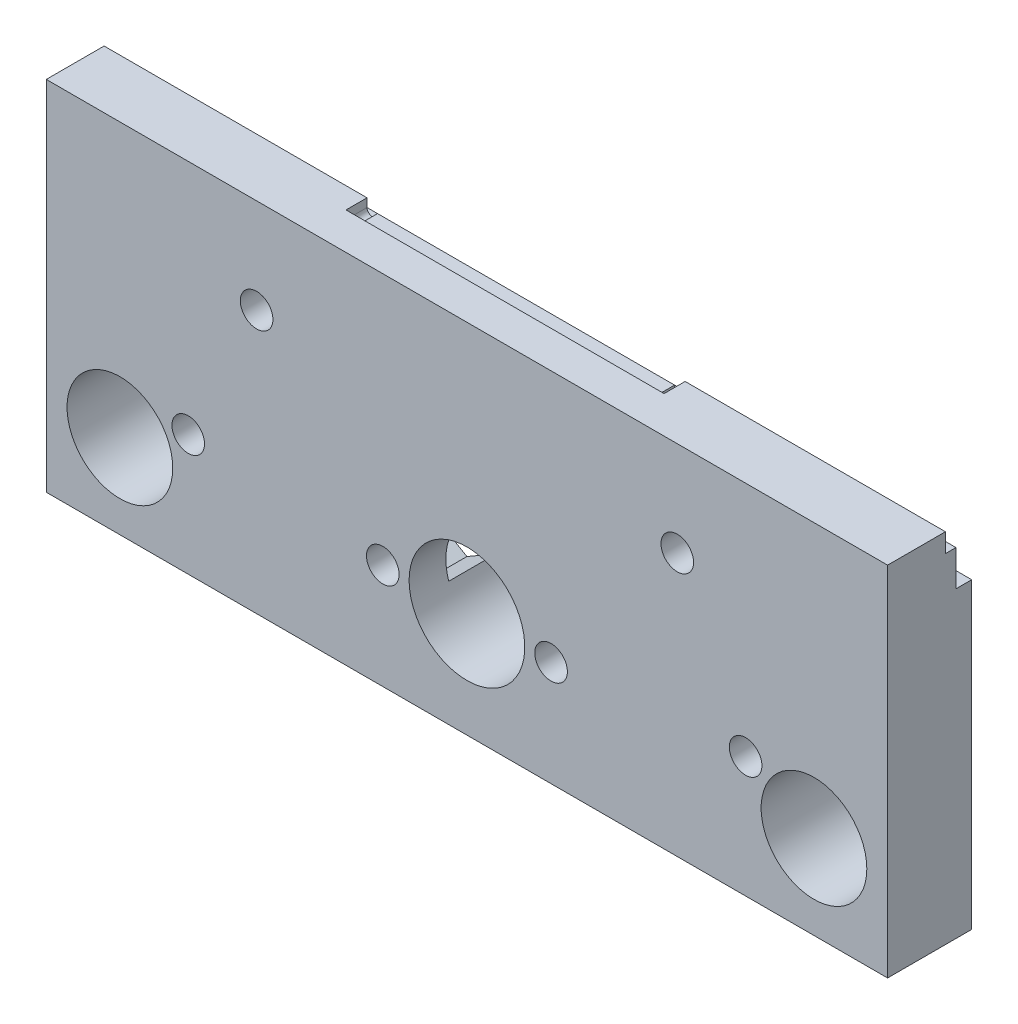
from build123d import *

# Parameters (mm, degrees)
SKETCH_2_W           = 80
SKETCH_2_H           = 34
SKETCH_2_R           = 5.025
SKETCH_2_R_2         = 4.05
EXTRUDE_1_DEPTH      = 8
CUT_EXTRUDE_2_DEPTH  = 88.292611371
SKETCH_5_R           = 1.55
CUT_EXTRUDE_3_DEPTH  = 88.292611371
CUT_EXTRUDE_5_DEPTH  = 4.5
SKETCH_11_R          = 1.55
CUT_EXTRUDE_7_DEPTH  = 88.292611371
CUT_EXTRUDE_11_DEPTH = 2
SKETCH_22_R          = 1.55
CUT_EXTRUDE_13_DEPTH = 88.292611371
SKETCH_20_R          = 5.5
CUT_EXTRUDE_14_DEPTH = 88.292611371


with BuildPart() as part:
    # 草图2 → 凸台-拉伸1 (new body)
    with BuildSketch(Plane.XY):
        with Locations((40, 17)):
            Rectangle(SKETCH_2_W, SKETCH_2_H)
        with Locations((7, 8)):
            Circle(SKETCH_2_R, mode=Mode.SUBTRACT)
        with Locations((40, 10)):
            Circle(SKETCH_2_R_2, mode=Mode.SUBTRACT)
        with Locations((73, 8)):
            Circle(SKETCH_2_R, mode=Mode.SUBTRACT)
    extrude(amount=EXTRUDE_1_DEPTH)

    # 草图4 → 切除-拉伸2 (cut, through all)
    with BuildSketch(Plane(origin=(80, 0, 0), x_dir=(0, 0, -1), z_dir=(1, 0, 0))):
        Polygon((-1.5, 32.2), (-2.5, 32.2), (-2.5, 34), (0, 34), (0, 28.8), (-1.5, 28.8), align=None)
    extrude(amount=-CUT_EXTRUDE_2_DEPTH, mode=Mode.SUBTRACT)

    # 草图5 → 切除-拉伸3 (cut, through all)
    with BuildSketch(Plane.XY.offset(8)):
        with Locations((48, 10)):
            Circle(SKETCH_5_R)
        with Locations((32, 10)):
            Circle(SKETCH_5_R)
    extrude(amount=-CUT_EXTRUDE_3_DEPTH, mode=Mode.SUBTRACT)

    # 草图8 → 切除-拉伸5 (cut)
    with BuildSketch(Plane(origin=(0, 0, 0), x_dir=(-1, 0, 0), z_dir=(0, 0, -1))):
        Polygon((-45.15, 8.354551733), (-45.15, 11.645448267), (-48, 13.290896534), (-50.85, 11.645448267), (-50.85, 8.354551733), (-48, 6.709103466), align=None)
        Polygon((-34.85, 8.354551733), (-32, 6.709103466), (-29.15, 8.354551733), (-29.15, 11.645448267), (-32, 13.290896534), (-34.85, 11.645448267), align=None)
    extrude(amount=-CUT_EXTRUDE_5_DEPTH, mode=Mode.SUBTRACT)

    # 草图11 → 切除-拉伸7 (cut, through all)
    with BuildSketch(Plane(origin=(0, 0, 0), x_dir=(-1, 0, 0), z_dir=(0, 0, -1))):
        with Locations((-60, 25)):
            Circle(SKETCH_11_R)
        with Locations((-20, 25)):
            Circle(SKETCH_11_R)
    extrude(amount=-CUT_EXTRUDE_7_DEPTH, mode=Mode.SUBTRACT)

    # 草图19 → 切除-拉伸11 (cut)
    with BuildSketch(Plane(origin=(0, 0, 2.5), x_dir=(-1, 0, 0), z_dir=(0, 0, -1))):
        with BuildLine():
            Line((-25, 34), (-55.247938178, 34))
            Line((-55.247938178, 34), (-55.247938178, 33.2))
            ThreePointArc((-55.247938178, 33.2), (-54.747938178, 32.7), (-54.247938178, 33.2))
            Line((-54.247938178, 33.2), (-26, 33.2))
            ThreePointArc((-26, 33.2), (-25.5, 32.7), (-25, 33.2))
            Line((-25, 33.2), (-25, 34))
        make_face()
    extrude(amount=-CUT_EXTRUDE_11_DEPTH, mode=Mode.SUBTRACT)

    # 草图22 → 切除-拉伸13 (cut, through all)
    with BuildSketch(Plane(origin=(0, 0, 0), x_dir=(-1, 0, 0), z_dir=(0, 0, -1))):
        with Locations((-66.5, 11.5)):
            Circle(SKETCH_22_R)
        with Locations((-13.5, 11.5)):
            Circle(SKETCH_22_R)
    extrude(amount=-CUT_EXTRUDE_13_DEPTH, mode=Mode.SUBTRACT)

    # 草图20 → 切除-拉伸14 (cut, through all)
    with BuildSketch(Plane(origin=(0, 0, 0), x_dir=(-1, 0, 0), z_dir=(0, 0, -1))):
        with Locations((-40, 10)):
            Circle(SKETCH_20_R)
    extrude(amount=-CUT_EXTRUDE_14_DEPTH, mode=Mode.SUBTRACT)


solid = part.part
